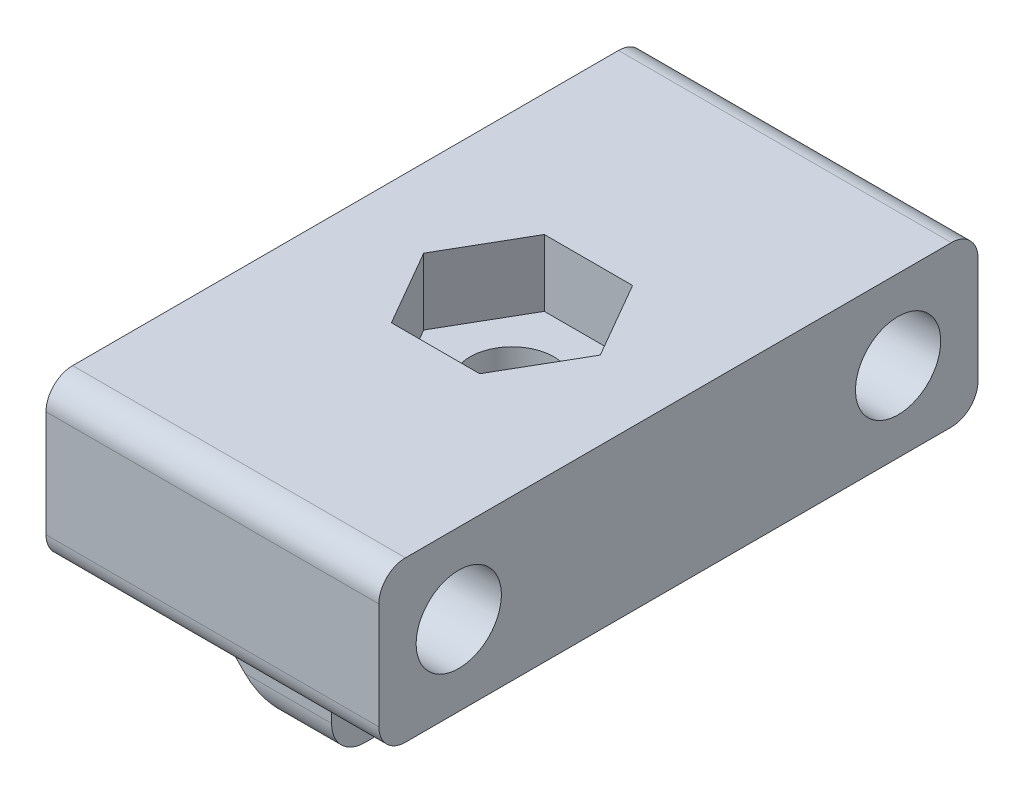
from build123d import *

# Parameters (mm, degrees)
SKETCH1_W           = 25
SKETCH1_H           = 45
BOSS_EXTRUDE1_DEPTH = 12
CUT_EXTRUDE1_DEPTH  = 5
SKETCH3_R           = 3.15
CUT_EXTRUDE2_DEPTH  = 27.673957337
SKETCH8_R           = 3.2
CUT_EXTRUDE5_DEPTH  = 36.710642671
FILLET1_R           = 2
SKETCH10_W          = 10
SKETCH10_H          = 37.099879626
BOSS_EXTRUDE2_DEPTH = 6
CHAMFER1_SIZE       = 6
FILLET2_R           = 2.5
FILLET3_R           = 1
SKETCH12_R          = 3.15
CUT_EXTRUDE6_DEPTH  = 6


# Some blends are built 0.0001 mm under size
with BuildPart() as part:
    # Sketch1 → Boss-Extrude1 (new body)
    with BuildSketch(Plane(origin=(0, 0, 0), x_dir=(1, 0, 0), z_dir=(0, 1, 0))):
        Rectangle(SKETCH1_W, SKETCH1_H)
    extrude(amount=BOSS_EXTRUDE1_DEPTH)

    # Sketch2 → Cut-Extrude1 (cut)
    with BuildSketch(Plane(origin=(0, 12, 0), x_dir=(1, 0, 0), z_dir=(0, 1, 0))):
        Polygon((3.315, -5.741748427), (6.63, 0), (3.315, 5.741748427), (-3.315, 5.741748427), (-6.63, 0), (-3.315, -5.741748427), align=None)
    extrude(amount=-CUT_EXTRUDE1_DEPTH, mode=Mode.SUBTRACT)

    # Sketch3 → Cut-Extrude2 (cut, through all)
    with BuildSketch(Plane(origin=(0, 7, 0), x_dir=(1, 0, 0), z_dir=(0, 1, 0))):
        with Locations(Location((0, 0, 0), (0, 0, 270))):
            Circle(SKETCH3_R)
    extrude(amount=-CUT_EXTRUDE2_DEPTH, mode=Mode.SUBTRACT)

    # Sketch8 → Cut-Extrude5 (cut, through all)
    with BuildSketch(Plane.ZY.offset(12.5)):
        with Locations((16.5, 6)):
            Circle(SKETCH8_R)
    cut_extrude5 = extrude(amount=-CUT_EXTRUDE5_DEPTH, mode=Mode.SUBTRACT)

    # Mirror1: Cut-Extrude5 across plane
    add(cut_extrude5.mirror(Plane.XY), mode=Mode.SUBTRACT)

    # Fillet1
    fillet1_edges = [part.edges().sort_by_distance(p)[0] for p in [
        (0, 12, -22.5),
        (0, 0, -22.5),
        (0, 0, 22.5),
        (0, 12, 22.5),
    ]]
    fillet(fillet1_edges, radius=FILLET1_R)

    # Sketch10 → Boss-Extrude2 (add)
    with BuildSketch(Plane(origin=(0, 0, 0), x_dir=(-1, 0, 0), z_dir=(0, -1, 0))):
        Rectangle(SKETCH10_W, SKETCH10_H)
    extrude(amount=BOSS_EXTRUDE2_DEPTH)

    # Chamfer1
    chamfer1_edges = [part.edges().sort_by_distance(p)[0] for p in [
        (-5, -6, 0),
    ]]
    chamfer(chamfer1_edges, length=CHAMFER1_SIZE - 0.0001)  # a hair under: the kernel refuses the full size

    # Fillet2
    fillet2_edges = [part.edges().sort_by_distance(p)[0] for p in [
        (2.99995, -6, 18.549939813),
        (2.99995, -6, -18.549939813),
    ]]
    fillet(fillet2_edges, radius=FILLET2_R)

    # Fillet3
    # the kernel refuses this fillet: 1 mm, written as the material it adds along each edge
    with BuildSketch(Plane(origin=(-7.5, 0, -18.549939813), x_dir=(0, 0, -1), z_dir=(1, 0, 0))) as fillet3_piece_1_section:
        with BuildLine():
            CenterArc((FILLET3_R, -FILLET3_R), FILLET3_R, 90, 90)
            Line((0, -FILLET3_R), (0, 0))
            Line((0, 0), (FILLET3_R, 0))
        make_face()
    fillet3_piece_1 = extrude(amount=12.5, mode=Mode.PRIVATE)
    fillet3_piece_1 = split(fillet3_piece_1, bisect_by=Plane(origin=(-5.010050002, 0.009950002, -19.039939721), z_dir=(0.7071067811865476, 0.7071067811865476, 0)), keep=Keep.TOP, mode=Mode.PRIVATE)
    add(fillet3_piece_1)
    with BuildSketch(Plane(origin=(5, 0, 18.549939813), x_dir=(0, -1, 0), z_dir=(-1, 0, 0))) as fillet3_piece_2_section:
        with BuildLine():
            CenterArc((FILLET3_R, FILLET3_R), FILLET3_R, 180, 90)
            Line((0, FILLET3_R), (0, 0))
            Line((0, 0), (FILLET3_R, 0))
        make_face()
    fillet3_piece_2 = extrude(amount=12.5, mode=Mode.PRIVATE)
    fillet3_piece_2 = split(fillet3_piece_2, bisect_by=Plane(origin=(-2.333623853, -2.666476147, 18.779122608), z_dir=(0.7071067811865476, 0.7071067811865476, 0)), keep=Keep.TOP, mode=Mode.PRIVATE)
    add(fillet3_piece_2)

    # Sketch12 → Cut-Extrude6 (cut)
    with BuildSketch(Plane(origin=(0, 0, 0), x_dir=(1, 0, 0), z_dir=(0, 1, 0))):
        with Locations(Location((0, 0, 0), (0, 0, 270))):
            Circle(SKETCH12_R)
    extrude(amount=-CUT_EXTRUDE6_DEPTH, mode=Mode.SUBTRACT)


solid = part.part
